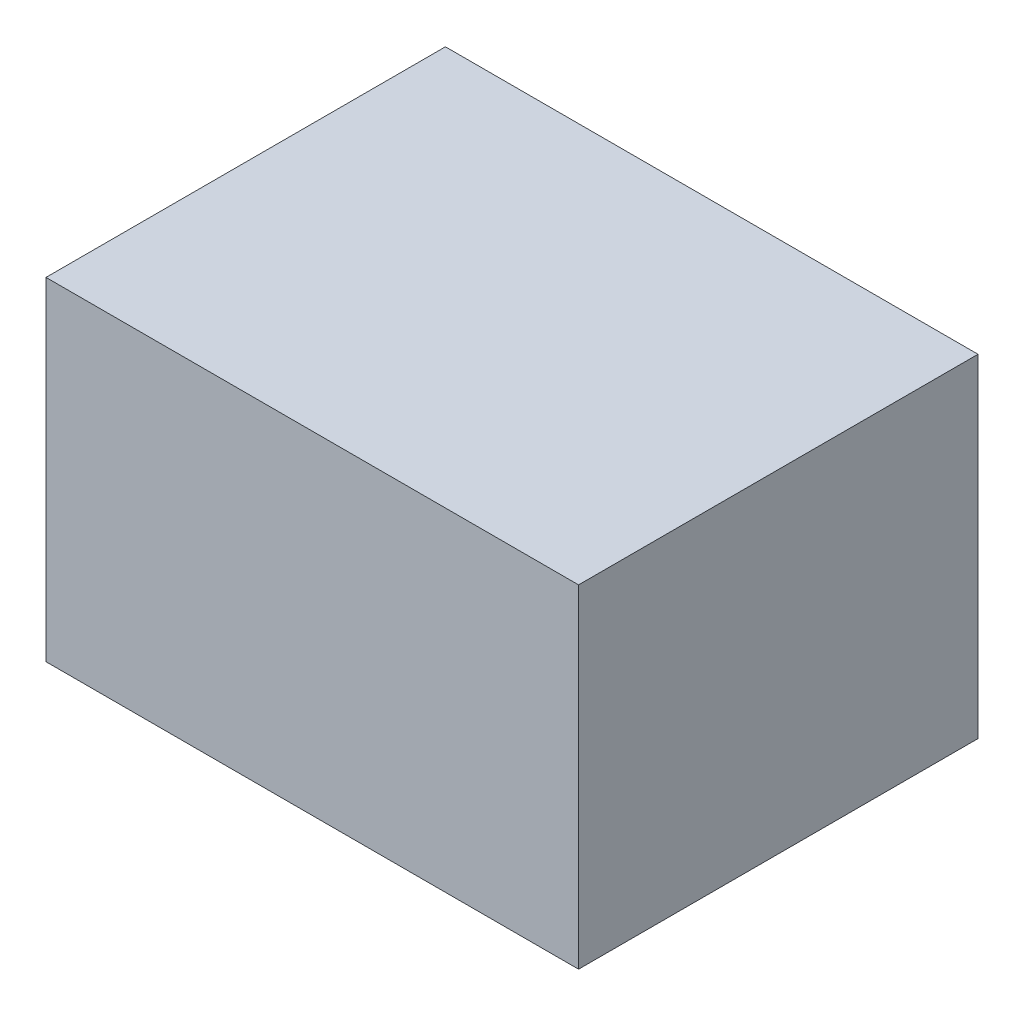
from build123d import *

# Parameters (mm, degrees)
SKETCH1_W           = 150
SKETCH1_H           = 125
BOSS_EXTRUDE1_DEPTH = 200


with BuildPart() as part:
    # Sketch1 → Boss-Extrude1 (new body)
    with BuildSketch(Plane(origin=(0, 0, 0), x_dir=(0, 0, -1), z_dir=(1, 0, 0))):
        with Locations((75, 62.5)):
            Rectangle(SKETCH1_W, SKETCH1_H)
    extrude(amount=BOSS_EXTRUDE1_DEPTH)


solid = part.part
